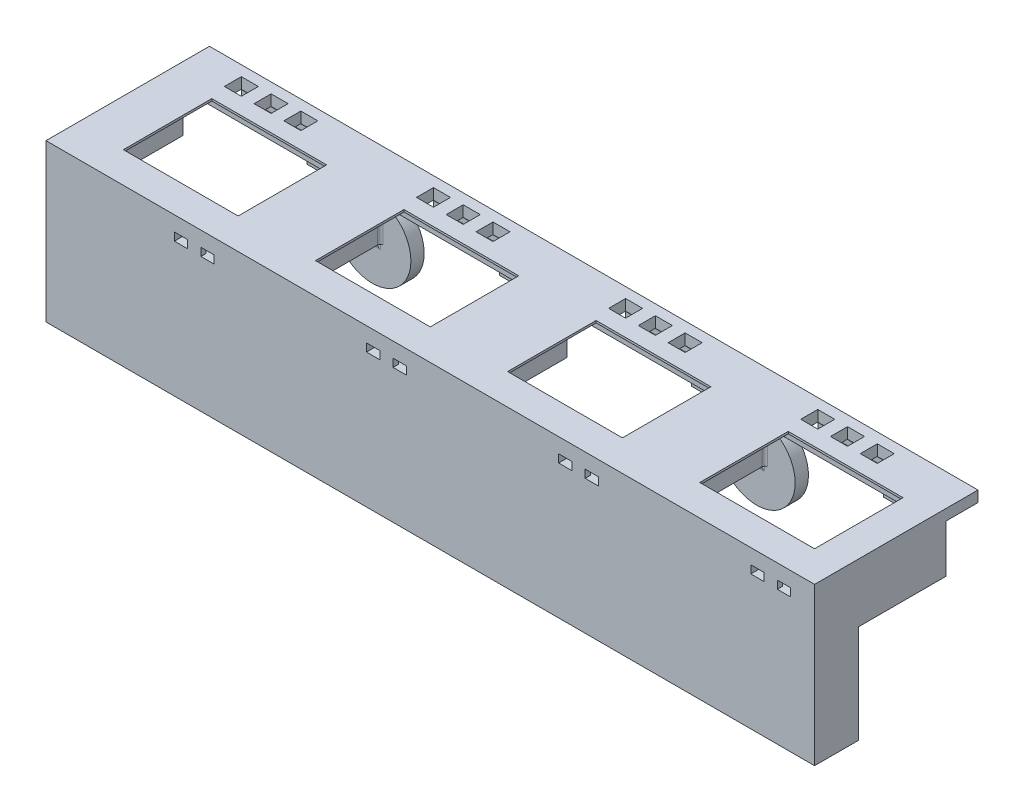
from build123d import *

# Parameters (mm, degrees)
SKETCH1_W               = 72.3
SKETCH1_H               = 56.5
SKETCH1_W_2             = 52.3
SKETCH1_H_2             = 36.5
BOSS_EXTRUDE1_DEPTH     = 3.3
SKETCH2_W               = 72.3
SKETCH2_H               = 2
BOSS_EXTRUDE2_DEPTH     = 45
SKETCH3_W               = 2
SKETCH3_H               = 45
BOSS_EXTRUDE3_DEPTH     = 54.5
SKETCH5_W               = 72.3
SKETCH5_H               = 56.5
SKETCH5_W_2             = 43.2
SKETCH5_H_2             = 33.3
BOSS_EXTRUDE6_DEPTH     = 0.8
SKETCH6_W               = 68.3
SKETCH6_H               = 1.5
BOSS_EXTRUDE7_DEPTH     = 7.8
BOSS_EXTRUDE8_DEPTH     = 7.8
SKETCH8_W               = 18.0427139
SKETCH8_H               = 6
SKETCH8_W_2             = 15
SKETCH8_H_2             = 3
BOSS_EXTRUDE9_DEPTH     = 10
SKETCH9_W               = 4
SKETCH9_H               = 26.5
CUT_EXTRUDE1_DEPTH      = 2
SKETCH10_W              = 2
SKETCH10_H              = 30
CUT_EXTRUDE2_DEPTH      = 40
SKETCH11_W              = 2
SKETCH11_H              = 1
BOSS_EXTRUDE10_DEPTH    = 20
SKETCH13_W              = 15
SKETCH13_H              = 3
BOSS_EXTRUDE11_DEPTH    = 5
SKETCH12_W              = 6.2
SKETCH12_H              = 6.2
CUT_EXTRUDE3_DEPTH      = 10
SKETCH14_W              = 18.0427139
SKETCH14_H              = 5
CUT_EXTRUDE4_DEPTH      = 25
SKETCH15_W              = 29.613072231
SKETCH15_H              = 15.101269166
CUT_EXTRUDE5_DEPTH      = 2
SKETCH17_W              = 5.5
SKETCH17_H              = 8
BOSS_EXTRUDE12_DEPTH    = 6
SKETCH20_W              = 2
SKETCH20_H              = 3
BOSS_EXTRUDE14_DEPTH    = 43
SKETCH21_R              = 14.5
BOSS_EXTRUDE15_DEPTH    = 8
SKETCH22_R              = 12.75
CUT_EXTRUDE6_DEPTH      = 6
FILLET1_R               = 2
SKETCH23_W              = 17.408302374
SKETCH23_H              = 1
BOSS_EXTRUDE16_DEPTH    = 2
BOSS_EXTRUDE17_REACH    = 131.062
SKETCH24_W              = 1.408302374
SKETCH24_H              = 2
SKETCH24_W_2            = 1.408302375
SKETCH25_W              = 17.4
SKETCH25_H              = 2
BOSS_EXTRUDE18_DEPTH    = 2
SKETCH26_W              = 6.4
SKETCH26_H              = 6.4
CUT_EXTRUDE7_DEPTH      = 4.1
SKETCH28_W              = 5
SKETCH28_H              = 3
CUT_EXTRUDE9_DEPTH      = 2
SKETCH29_R              = 14.5
SKETCH29_R_2            = 12.75
CUT_EXTRUDE10_DEPTH     = 3
FILLET2_R               = 10
BOSS_EXTRUDE19_DEPTH    = 10
CUT_EXTRUDE11_DEPTH     = 10
LPATTERN3_COUNT         = 4
LPATTERN3_PITCH         = 72.3
CUT_EXTRUDE12_DEPTH     = 12.000004
SKETCH33_W              = 18.04
SKETCH33_H              = 6
SKETCH33_W_2            = 15
SKETCH33_H_2            = 3
SKETCH33_W_3            = 17.84
BOSS_EXTRUDE20_DEPTH    = 8
SKETCH34_W              = 2
SKETCH34_H              = 2
BOSS_EXTRUDE21_DEPTH    = 18
FILLET3_R               = 1
SKETCH35_W              = 2
SKETCH35_H              = 20
CUT_EXTRUDE14_DEPTH     = 3.4
BOSS_EXTRUDE22_DEPTH    = 3.4
SKETCH37_W              = 2
SKETCH37_H              = 20
BOSS_EXTRUDE23_DEPTH    = 1.000004
SKETCH38_W              = 11.7
SKETCH38_H              = 44
CUT_EXTRUDE15_DEPTH     = 3.4
SKETCH39_W              = 11.7
SKETCH39_H              = 8
BOSS_EXTRUDE24_DEPTH    = 9.6
LPATTERN4_START         = -60.397033621
LPATTERN4_OUTLINE_W     = 6.4
LPATTERN4_OUTLINE_H     = 4.1
LPATTERN4_DEPTH         = 6.4
LPATTERN4_START_2       = -62.297033621
LPATTERN4_2_OUTLINE_W   = 11.2
LPATTERN4_2_OUTLINE_H   = 2
LPATTERN4_2_DEPTH       = 2
LPATTERN4_START_3       = -54.097033621
LPATTERN4_3_OUTLINE_W   = 11.191697626
LPATTERN4_3_OUTLINE_H   = 2
LPATTERN4_3_DEPTH       = 1
LPATTERN4_START_4       = -60.297033621
LPATTERN4_4_OUTLINE_W   = 1.408302374
LPATTERN4_4_OUTLINE_H   = 2
LPATTERN4_4_OUTLINE_W_2 = 0.008302375
LPATTERN4_4_DEPTH       = 6.2


# Read off the part's stored shape, not the designer's step: LPattern4
with BuildPart() as part:
    # Sketch1 → Boss-Extrude1 (new body)
    with BuildSketch(Plane(origin=(0, 0, 0), x_dir=(1, 0, 0), z_dir=(0, 1, 0))):
        with Locations((59.895731411, 31.047033621)):
            Rectangle(SKETCH1_W, SKETCH1_H)
        with Locations((59.895731411, 31.047033621)):
            Rectangle(SKETCH1_W_2, SKETCH1_H_2, mode=Mode.SUBTRACT)
    extrude(amount=BOSS_EXTRUDE1_DEPTH)

    # Sketch2 → Boss-Extrude2 (add)
    with BuildSketch(Plane.XZ):
        with Locations((59.895731411, -3.797033621)):
            Rectangle(SKETCH2_W, SKETCH2_H)
    extrude(amount=BOSS_EXTRUDE2_DEPTH)

    # Sketch3 → Boss-Extrude3 (add)
    with BuildSketch(Plane(origin=(0, 0, -4.797033621), x_dir=(-1, 0, 0), z_dir=(0, 0, -1))):
        with Locations((-95.045731411, -22.5)):
            Rectangle(SKETCH3_W, SKETCH3_H)
        with Locations((-24.745731411, -22.5)):
            Rectangle(SKETCH3_W, SKETCH3_H)
    extrude(amount=BOSS_EXTRUDE3_DEPTH)

    # Sketch5 → Boss-Extrude6 (add)
    with BuildSketch(Plane(origin=(0, 3.3, 0), x_dir=(1, 0, 0), z_dir=(0, 1, 0))):
        with Locations((59.895731411, 31.047033621)):
            Rectangle(SKETCH5_W, SKETCH5_H)
        with Locations((62.845731411, 31.047033621)):
            Rectangle(SKETCH5_W_2, SKETCH5_H_2, mode=Mode.SUBTRACT)
    extrude(amount=BOSS_EXTRUDE6_DEPTH)

    # Sketch6 → Boss-Extrude7 (add)
    with BuildSketch(Plane(origin=(0, 0, -4.797033621), x_dir=(-1, 0, 0), z_dir=(0, 0, -1))):
        with Locations((-59.895731411, -0.75)):
            Rectangle(SKETCH6_W, SKETCH6_H)
    extrude(amount=BOSS_EXTRUDE7_DEPTH)

    # Sketch7 → Boss-Extrude8 (add)
    with BuildSketch(Plane(origin=(0, 0, -4.797033621), x_dir=(-1, 0, 0), z_dir=(0, 0, -1))):
        Polygon((-87.045731411, -1.5), (-87.045731411, -4.5), (-72.045731411, -4.5), (-72.045731411, -1.5), (-70.545731411, -1.5), (-70.545731411, -6), (-88.545731411, -6), (-88.545731411, -1.5), align=None)
    extrude(amount=BOSS_EXTRUDE8_DEPTH)

    # Sketch8 → Boss-Extrude9 (add)
    with BuildSketch(Plane(origin=(0, 0, -59.297033621), x_dir=(-1, 0, 0), z_dir=(0, 0, -1))):
        with Locations((-79.524374461, -3)):
            Rectangle(SKETCH8_W, SKETCH8_H)
        with Locations((-79.545731411, -3)):
            Rectangle(SKETCH8_W_2, SKETCH8_H_2, mode=Mode.SUBTRACT)
    extrude(amount=-BOSS_EXTRUDE9_DEPTH)

    # Sketch9 → Cut-Extrude1 (cut)
    with BuildSketch(Plane.XZ):
        with Locations((88.045731411, -31.047033621)):
            Rectangle(SKETCH9_W, SKETCH9_H)
    extrude(amount=-CUT_EXTRUDE1_DEPTH, mode=Mode.SUBTRACT)

    # Sketch10 → Cut-Extrude2 (cut)
    with BuildSketch(Plane(origin=(0, 0, -59.297033621), x_dir=(-1, 0, 0), z_dir=(0, 0, -1))):
        with Locations((-95.045731411, -30)):
            Rectangle(SKETCH10_W, SKETCH10_H)
    extrude(amount=-CUT_EXTRUDE2_DEPTH, mode=Mode.SUBTRACT)

    # Sketch11 → Boss-Extrude10 (add)
    with BuildSketch(Plane.XZ.offset(1.5)):
        with Locations((93.045731411, -7.697033621)):
            Rectangle(SKETCH11_W, SKETCH11_H)
        with Locations((26.745731411, -7.697033621)):
            Rectangle(SKETCH11_W, SKETCH11_H)
    extrude(amount=BOSS_EXTRUDE10_DEPTH)

    # Sketch13 → Boss-Extrude11 (add)
    with BuildSketch(Plane(origin=(0, 0, -59.297033621), x_dir=(-1, 0, 0), z_dir=(0, 0, -1))):
        Polygon((-96.045731411, 4.1), (-96.045731411, -15), (-94.045731411, -15), (-94.045731411, 0), (-88.545731411, 0), (-88.545731411, -6), (-70.503017511, -6), (-70.503017511, 0), (-25.745731411, 0), (-25.745731411, -45), (-23.745731411, -45), (-23.745731411, 4.1), align=None)
        with Locations((-79.545731411, -3)):
            Rectangle(SKETCH13_W, SKETCH13_H, mode=Mode.SUBTRACT)
    extrude(amount=BOSS_EXTRUDE11_DEPTH)

    # Sketch12 → Cut-Extrude3 (cut)
    with BuildSketch(Plane(origin=(0, 4.1, 0), x_dir=(1, 0, 0), z_dir=(0, 1, 0))):
        with Locations((42.845731411, 57.197033621)):
            Rectangle(SKETCH12_W, SKETCH12_H)
        with Locations((54.045731411, 57.197033621)):
            Rectangle(SKETCH12_W, SKETCH12_H)
    extrude(amount=-CUT_EXTRUDE3_DEPTH, mode=Mode.SUBTRACT)

    # Sketch14 → Cut-Extrude4 (cut)
    with BuildSketch(Plane.XZ):
        with Locations((79.524374461, -51.797033621)):
            Rectangle(SKETCH14_W, SKETCH14_H)
    extrude(amount=CUT_EXTRUDE4_DEPTH, mode=Mode.SUBTRACT)

    # Sketch15 → Cut-Extrude5 (cut)
    with BuildSketch(Plane(origin=(0, 0, -64.297033621), x_dir=(-1, 0, 0), z_dir=(0, 0, -1))):
        with Locations((-85.309553627, -7.550634583)):
            Rectangle(SKETCH15_W, SKETCH15_H)
    extrude(amount=-CUT_EXTRUDE5_DEPTH, mode=Mode.SUBTRACT)

    # Sketch17 → Boss-Extrude12 (add)
    with BuildSketch(Plane.XZ):
        with Locations((91.295731411, -58.297033621)):
            Rectangle(SKETCH17_W, SKETCH17_H)
    extrude(amount=BOSS_EXTRUDE12_DEPTH)

    # Sketch20 → Boss-Extrude14 (add)
    with BuildSketch(Plane(origin=(0, 0, -19.297033621), x_dir=(-1, 0, 0), z_dir=(0, 0, -1))):
        with Locations((-95.045731411, -16.5)):
            Rectangle(SKETCH20_W, SKETCH20_H)
    extrude(amount=BOSS_EXTRUDE14_DEPTH)

    # Sketch21 → Boss-Extrude15 (add)
    with BuildSketch(Plane(origin=(0, 0, -62.297033621), x_dir=(-1, 0, 0), z_dir=(0, 0, -1))):
        with Locations((-95.045731411, -18)):
            Circle(SKETCH21_R)
    extrude(amount=-BOSS_EXTRUDE15_DEPTH)

    # Sketch22 → Cut-Extrude6 (cut)
    with BuildSketch(Plane(origin=(0, 0, -62.297033621), x_dir=(-1, 0, 0), z_dir=(0, 0, -1))):
        with Locations((-95.045731411, -18)):
            Circle(SKETCH22_R)
    extrude(amount=-CUT_EXTRUDE6_DEPTH, mode=Mode.SUBTRACT)

    # Fillet1
    fillet1_edges = [part.edges().sort_by_distance(p)[0] for p in [
        (94.045731411, -9, -54.297033621),
        (95.045731411, -18, -54.297033621),
        (96.045731411, -10.767261929, -54.297033621),
    ]]
    fillet(fillet1_edges, radius=FILLET1_R)

    # Sketch23 → Boss-Extrude16 (add)
    with BuildSketch(Plane.XZ):
        with Locations((48.449882598, -53.597033621)):
            Rectangle(SKETCH23_W, SKETCH23_H)
    boss_extrude16 = extrude(amount=BOSS_EXTRUDE16_DEPTH)

    # Boss-Extrude17: up to this face of the body (flat: up to its plane)
    boss_extrude17_end = Plane(part.part.faces().sort_by_distance((83.274374461, -0.50799444, -62.297033621))[0])
    # Sketch24 → Boss-Extrude17 (add, up to the picked face)
    with BuildSketch(Plane(origin=(0, 0, -54.097033621), x_dir=(-1, 0, 0), z_dir=(0, 0, -1)), mode=Mode.PRIVATE) as boss_extrude17_sk1:
        with Locations((-54.049882598, -1)):
            Rectangle(SKETCH24_W, SKETCH24_H)
    boss_extrude17_tool1 = split(extrude(boss_extrude17_sk1.sketch, amount=BOSS_EXTRUDE17_REACH, mode=Mode.PRIVATE), bisect_by=boss_extrude17_end, keep=Keep.BOTH, mode=Mode.PRIVATE)
    # Sketch24 → Boss-Extrude17 (add, up to the picked face)
    with BuildSketch(Plane(origin=(0, 0, -54.097033621), x_dir=(-1, 0, 0), z_dir=(0, 0, -1)), mode=Mode.PRIVATE) as boss_extrude17_sk2:
        with Locations((-42.841580224, -1)):
            Rectangle(SKETCH24_W_2, SKETCH24_H)
    boss_extrude17_tool2 = split(extrude(boss_extrude17_sk2.sketch, amount=BOSS_EXTRUDE17_REACH, mode=Mode.PRIVATE), bisect_by=boss_extrude17_end, keep=Keep.BOTH, mode=Mode.PRIVATE)
    boss_extrude17_1 = boss_extrude17_tool1.solids().sort_by(Axis((54.049883, -1, -54.097034), (0, 0, -1)))[0]
    add(boss_extrude17_1)
    boss_extrude17_2 = boss_extrude17_tool2.solids().sort_by(Axis((42.84158, -1, -54.097034), (0, 0, -1)))[0]
    add(boss_extrude17_2)
    boss_extrude17 = boss_extrude17_1 + boss_extrude17_2  # Boss-Extrude17 as one shape, for the pattern or mirror that repeats it

    # Sketch25 → Boss-Extrude18 (add)
    with BuildSketch(Plane.XZ):
        with Locations((48.445731411, -61.297033621)):
            Rectangle(SKETCH25_W, SKETCH25_H)
    boss_extrude18 = extrude(amount=BOSS_EXTRUDE18_DEPTH)

    # Sketch26 → Cut-Extrude7 (cut)
    with BuildSketch(Plane(origin=(0, 4.1, 0), x_dir=(1, 0, 0), z_dir=(0, 1, 0))):
        with Locations((42.845731411, 57.197033621)):
            Rectangle(SKETCH26_W, SKETCH26_H)
        with Locations((54.045731411, 57.197033621)):
            Rectangle(SKETCH26_W, SKETCH26_H)
    cut_extrude7 = extrude(amount=-CUT_EXTRUDE7_DEPTH, mode=Mode.SUBTRACT)

    # Sketch28 → Cut-Extrude9 (cut)
    with BuildSketch(Plane(origin=(0, 0, -4.797033621), x_dir=(-1, 0, 0), z_dir=(0, 0, -1))):
        with Locations((-84.545731411, -3)):
            Rectangle(SKETCH28_W, SKETCH28_H)
        with Locations((-74.545731411, -3)):
            Rectangle(SKETCH28_W, SKETCH28_H)
    extrude(amount=-CUT_EXTRUDE9_DEPTH, mode=Mode.SUBTRACT)

    # Sketch29 → Cut-Extrude10 (cut)
    with BuildSketch(Plane(origin=(0, 0, -62.297033621), x_dir=(-1, 0, 0), z_dir=(0, 0, -1))):
        with Locations((-95.045731411, -18)):
            Circle(SKETCH29_R)
        with Locations((-95.045731411, -18)):
            Circle(SKETCH29_R_2, mode=Mode.SUBTRACT)
    extrude(amount=-CUT_EXTRUDE10_DEPTH, mode=Mode.SUBTRACT)

    # Fillet2
    fillet2_edges = [part.edges().sort_by_distance(p)[0] for p in [
        (96.045731411, -3.534523859, -55.797033621),
    ]]
    fillet(fillet2_edges, radius=FILLET2_R)

    # Sketch30 → Boss-Extrude19 (add)
    with BuildSketch(Plane.XZ.offset(45)):
        Polygon((94.045731411, -19.297033621), (96.045731411, -19.297033621), (96.045731411, -2.797033621), (23.745731411, -2.797033621), (23.745731411, -64.297033621), (25.745731411, -64.297033621), (25.745731411, -4.797033621), (94.045731411, -4.797033621), align=None)
    extrude(amount=BOSS_EXTRUDE19_DEPTH)

    # Sketch31 → Cut-Extrude11 (cut)
    with BuildSketch(Plane(origin=(25.745731411, 0, 0), x_dir=(0, 0, -1), z_dir=(1, 0, 0))):
        Polygon((19.297033621, -55), (19.297033621, -18), (52.297033621, -18), (52.297033621, 0), (64.297033621, 0), (64.297033621, -55), align=None)
    extrude(amount=-CUT_EXTRUDE11_DEPTH, mode=Mode.SUBTRACT)


with BuildPart() as lpattern3_1:
    # LPattern3: pattern copy
    add(part.part.moved(Location(Vector(1, 0, 0) * (1 * LPATTERN3_PITCH))))


with BuildPart() as lpattern3_2:
    # LPattern3: pattern copy
    add(part.part.moved(Location(Vector(1, 0, 0) * (2 * LPATTERN3_PITCH))))


with BuildPart() as lpattern3_3:
    # LPattern3: pattern copy
    add(part.part.moved(Location(Vector(1, 0, 0) * (3 * LPATTERN3_PITCH))))


with BuildPart() as cut_extrude12_tool:
    # Sketch32 → Cut-Extrude12 (new body)
    with BuildSketch(Plane(origin=(0, 0, -64.297033621), x_dir=(-1, 0, 0), z_dir=(0, 0, -1))):
        Polygon((-305.485731411, 0), (-305.485731411, -6.006861521), (-303.806321113, -6), (-292.560480346, -10.934956905), (-292.560480346, -41.496815232), (-337.305742536, -41.496815232), (-337.305742536, 6.034472718), (-312.945731411, 6.034472718), (-312.945731411, 0), align=None)
        Polygon((-168.145731411, 0), (-160.685731411, 0), (-160.685731411, -6.006861521), (-159.006321113, -6), (-147.760480346, -10.934956905), (-147.760480346, -41.496815232), (-192.505742536, -41.496815232), (-192.505742536, -13.983635579), (-173.951253289, 0), align=None)
    extrude(amount=-CUT_EXTRUDE12_DEPTH)


with BuildPart() as lpattern3_1_1:
    add(lpattern3_1.part)

    # Cut-Extrude12: cut by cut_extrude12_tool
    add(cut_extrude12_tool.part, mode=Mode.SUBTRACT)



with BuildPart() as lpattern3_2_1:
    add(lpattern3_2.part)

    # Cut-Extrude12: cut by cut_extrude12_tool
    add(cut_extrude12_tool.part, mode=Mode.SUBTRACT)


with BuildPart() as lpattern3_3_1:
    add(lpattern3_3.part)

    # Cut-Extrude12: cut by cut_extrude12_tool
    add(cut_extrude12_tool.part, mode=Mode.SUBTRACT)


with BuildPart() as lpattern3_1_2:
    add(lpattern3_1_1.part)

    add(lpattern3_3_1.part)  # Boss-Extrude20 merges LPattern3_3
    # Sketch33 → Boss-Extrude20 (add)
    # profile 1 of 2: a face of its own
    with BuildSketch(Plane(origin=(0, 0, -62.297033621), x_dir=(-1, 0, 0), z_dir=(0, 0, -1))):
        with Locations((-296.465731411, -3)):
            Rectangle(SKETCH33_W, SKETCH33_H)
        with Locations((-296.445731411, -3)):
            Rectangle(SKETCH33_W_2, SKETCH33_H_2, mode=Mode.SUBTRACT)
    # profile 2 of 2: a face of its own
    with BuildSketch(Plane(origin=(0, 0, -62.297033621), x_dir=(-1, 0, 0), z_dir=(0, 0, -1))):
        with Locations((-151.765731411, -3)):
            Rectangle(SKETCH33_W_3, SKETCH33_H)
        with Locations((-151.845731411, -3)):
            Rectangle(SKETCH33_W_2, SKETCH33_H_2, mode=Mode.SUBTRACT)
    extrude(amount=-BOSS_EXTRUDE20_DEPTH)


with BuildPart() as part_1:
    add(part.part)

    add(lpattern3_1_2.part)  # Boss-Extrude21 merges LPattern3_1

    add(lpattern3_2_1.part)  # Boss-Extrude21 merges LPattern3_2
    # Sketch34 → Boss-Extrude21 (add)
    with BuildSketch(Plane.XZ):
        with Locations((241.645731411, -53.297033621)):
            Rectangle(SKETCH34_W, SKETCH34_H)
        with Locations((97.045731411, -53.297033621)):
            Rectangle(SKETCH34_W, SKETCH34_H)
    extrude(amount=BOSS_EXTRUDE21_DEPTH)

    # Fillet3
    fillet3_edges = [part_1.edges().sort_by_distance(p)[0] for p in [
        (98.045731411, -10.054110361, -54.297033621),
        (242.645731411, -10.054110361, -54.297033621),
    ]]
    fillet(fillet3_edges, radius=FILLET3_R)

    # Sketch35 → Cut-Extrude14 (cut)
    with BuildSketch(Plane(origin=(0, 0, -4.797033621), x_dir=(-1, 0, 0), z_dir=(0, 0, -1))):
        with Locations((-165.345731411, -11.5)):
            Rectangle(SKETCH35_W, SKETCH35_H)
    extrude(amount=CUT_EXTRUDE14_DEPTH, mode=Mode.SUBTRACT)

    # Sketch36 → Boss-Extrude22 (add)
    with BuildSketch(Plane(origin=(0, 0, -4.797033621), x_dir=(-1, 0, 0), z_dir=(0, 0, -1))):
        Polygon((-166.345731411, -1.5), (-160.845731411, -1.5), (-160.845731411, -6), (-142.845731411, -6), (-142.845731411, -55), (-166.345731411, -55), align=None)
    extrude(amount=BOSS_EXTRUDE22_DEPTH)

    # Sketch37 → Boss-Extrude23 (add)
    with BuildSketch(Plane(origin=(0, 0, -8.197033621), x_dir=(-1, 0, 0), z_dir=(0, 0, -1))):
        with Locations((-141.845731411, -11.5)):
            Rectangle(SKETCH37_W, SKETCH37_H)
    extrude(amount=-BOSS_EXTRUDE23_DEPTH)

    # Sketch38 → Cut-Extrude15 (cut)
    with BuildSketch(Plane(origin=(0, 0, -8.197033621), x_dir=(-1, 0, 0), z_dir=(0, 0, -1))):
        with Locations((-160.495731411, -33)):
            Rectangle(SKETCH38_W, SKETCH38_H)
    extrude(amount=-CUT_EXTRUDE15_DEPTH, mode=Mode.SUBTRACT)

    # Sketch39 → Boss-Extrude24 (add)
    with BuildSketch(Plane(origin=(0, 0, -4.797033621), x_dir=(-1, 0, 0), z_dir=(0, 0, -1))):
        with Locations((-160.495731411, -51)):
            Rectangle(SKETCH39_W, SKETCH39_H)
    extrude(amount=BOSS_EXTRUDE24_DEPTH)

    # Mirror1: Boss-Extrude16, Boss-Extrude17, Boss-Extrude18, Cut-Extrude7 across plane
    add(boss_extrude16.mirror(Plane(origin=(54.045731411, 0, 0), x_dir=(0, 0, 1), z_dir=(1, 0, 0))))
    add(boss_extrude17.mirror(Plane(origin=(54.045731411, 0, 0), x_dir=(0, 0, 1), z_dir=(1, 0, 0))))
    add(boss_extrude18.mirror(Plane(origin=(54.045731411, 0, 0), x_dir=(0, 0, 1), z_dir=(1, 0, 0))))
    add(cut_extrude7.mirror(Plane(origin=(54.045731411, 0, 0), x_dir=(0, 0, 1), z_dir=(1, 0, 0))), mode=Mode.SUBTRACT)

    # LPattern4 outline → LPattern4 (cut)
    with BuildSketch(Plane.XY.offset(LPATTERN4_START)):
        with Locations((137.545731411, 2.05)):
            Rectangle(LPATTERN4_OUTLINE_W, LPATTERN4_OUTLINE_H)
        with Locations((209.845731411, 2.05)):
            Rectangle(LPATTERN4_OUTLINE_W, LPATTERN4_OUTLINE_H)
        with Locations((282.145731411, 2.05)):
            Rectangle(LPATTERN4_OUTLINE_W, LPATTERN4_OUTLINE_H)
    extrude(amount=LPATTERN4_DEPTH, mode=Mode.SUBTRACT)

    # LPattern4 2 outline → LPattern4 2 (add)
    with BuildSketch(Plane.XY.offset(LPATTERN4_START_2)):
        with Locations((135.045731411, -1)):
            Rectangle(LPATTERN4_2_OUTLINE_W, LPATTERN4_2_OUTLINE_H)
        with Locations((207.345731411, -1)):
            Rectangle(LPATTERN4_2_OUTLINE_W, LPATTERN4_2_OUTLINE_H)
        with Locations((279.645731411, -1)):
            Rectangle(LPATTERN4_2_OUTLINE_W, LPATTERN4_2_OUTLINE_H)
    extrude(amount=LPATTERN4_2_DEPTH)

    # LPattern4 3 outline → LPattern4 3 (add)
    with BuildSketch(Plane.XY.offset(LPATTERN4_START_3)):
        with Locations((135.049882598, -1)):
            Rectangle(LPATTERN4_3_OUTLINE_W, LPATTERN4_3_OUTLINE_H)
        with Locations((207.349882598, -1)):
            Rectangle(LPATTERN4_3_OUTLINE_W, LPATTERN4_3_OUTLINE_H)
        with Locations((279.649882598, -1)):
            Rectangle(LPATTERN4_3_OUTLINE_W, LPATTERN4_3_OUTLINE_H)
    extrude(amount=LPATTERN4_3_DEPTH)

    # LPattern4 4 outline → LPattern4 4 (add)
    with BuildSketch(Plane.XY.offset(LPATTERN4_START_4)):
        with Locations((137.549882598, -1)):
            Rectangle(LPATTERN4_4_OUTLINE_W, LPATTERN4_4_OUTLINE_H)
        with Locations((197.941580224, -1)):
            Rectangle(LPATTERN4_4_OUTLINE_W_2, LPATTERN4_4_OUTLINE_H)
        with Locations((125.641580224, -1)):
            Rectangle(LPATTERN4_4_OUTLINE_W_2, LPATTERN4_4_OUTLINE_H)
        with Locations((209.849882598, -1)):
            Rectangle(LPATTERN4_4_OUTLINE_W, LPATTERN4_4_OUTLINE_H)
        with Locations((270.241580224, -1)):
            Rectangle(LPATTERN4_4_OUTLINE_W_2, LPATTERN4_4_OUTLINE_H)
        with Locations((282.149882598, -1)):
            Rectangle(LPATTERN4_4_OUTLINE_W, LPATTERN4_4_OUTLINE_H)
    extrude(amount=LPATTERN4_4_DEPTH)


solid = part_1.part
